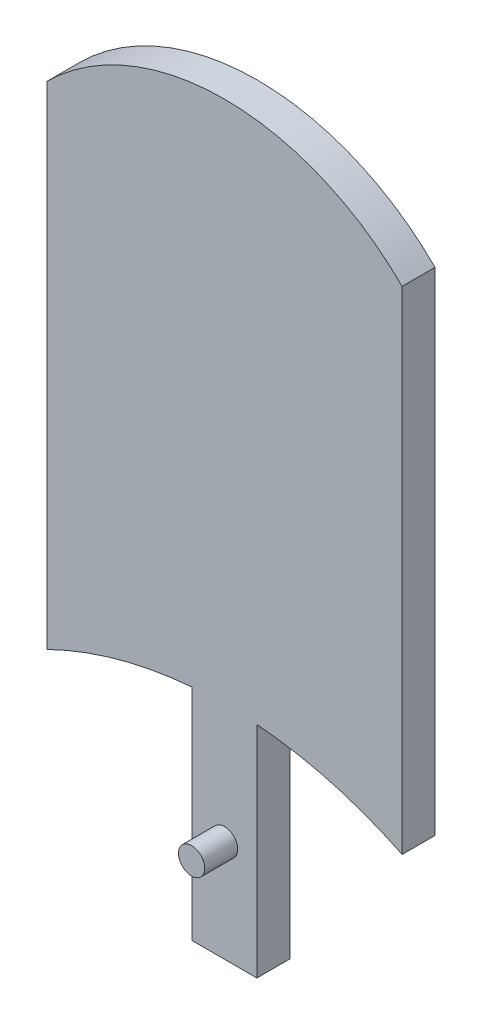
from build123d import *
from build123d.topology import SkipClean

# Parameters (mm, degrees)
BOSS_EXTRUDE1_DEPTH = 3.175
BOSS_EXTRUDE2_START = 3.175
BOSS_EXTRUDE2_DEPTH = 3.175
SKETCH3_W           = 6.236959702
SKETCH3_H           = 41.352711554
BOSS_EXTRUDE3_DEPTH = 3.175
BOSS_EXTRUDE4_DEPTH = 3.175
BOSS_EXTRUDE5_REACH = 47.548
SKETCH6_W           = 0.889
SKETCH6_H           = 43.066281197
CUT_EXTRUDE1_REACH  = 47.451


with BuildPart() as part:
    # Sketch1 → Boss-Extrude1 (new body)
    with BuildSketch(Plane.XY):
        with BuildLine():
            Line((-17.114253333, 23.707583903), (-17.114253333, -23.707583903))
            ThreePointArc((-17.114253333, -23.707583903), (0, -19.732802645), (17.114253333, -23.707583903))
            Line((17.114253333, -23.707583903), (17.114253333, 23.707583903))
            ThreePointArc((17.114253333, 23.707583903), (0, 30.782200079), (-17.114253333, 23.707583903))
        make_face()
    extrude(amount=BOSS_EXTRUDE1_DEPTH)

    # Sketch2 → Boss-Extrude2 (add)
    with SkipClean():  # the faces are left unmerged after this step: merging them gives an invalid solid
        with BuildSketch(Plane(origin=(0, 0, 0), x_dir=(-1, 0, 0), z_dir=(0, 0, -1)).offset(BOSS_EXTRUDE2_START)):
            with BuildLine():
                Line((1.65128862, 23.29835294), (1.65128862, -19.767928257))
                ThreePointArc((1.65128862, -19.767928257), (2.25262846, -19.798194915), (2.853426735, -19.837781624))
                Line((2.853426735, -19.837781624), (2.853426735, 23.29835294))
                Line((2.853426735, 23.29835294), (1.65128862, 23.29835294))
            make_face()
            with BuildLine():
                Line((-1.65128862, -19.767928257), (-1.65128862, 23.29835294))
                Line((-1.65128862, 23.29835294), (-2.853426735, 23.29835294))
                Line((-2.853426735, 23.29835294), (-2.853426735, -19.837781624))
                ThreePointArc((-2.853426735, -19.837781624), (-2.25262846, -19.798194915), (-1.65128862, -19.767928257))
            make_face()
        extrude(amount=-BOSS_EXTRUDE2_DEPTH)

    # Sketch3 → Boss-Extrude3 (add)
    with BuildSketch(Plane.XY.offset(3.175)):
        with Locations((0, -20.33746726)):
            Rectangle(SKETCH3_W, SKETCH3_H)
    extrude(amount=-BOSS_EXTRUDE3_DEPTH)

    # Sketch4 → Boss-Extrude4 (add)
    with BuildSketch(Plane.XY.offset(3.175)):
        with BuildLine():
            ThreePointArc((0, -32.471683403), (0.898025612, -32.099709016), (1.27, -31.201683403))
            ThreePointArc((1.27, -31.201683403), (-0.898025612, -30.303657791), (0, -32.471683403))
        make_face()
    extrude(amount=BOSS_EXTRUDE4_DEPTH)

    # Sketch6 → Boss-Extrude5 (add, up to next)
    with BuildSketch(Plane.ZY.offset(-1.65128862), mode=Mode.PRIVATE) as boss_extrude5_sk1:
        with Locations((-2.7305, 1.765212341)):
            Rectangle(SKETCH6_W, SKETCH6_H)
    boss_extrude5_tool1 = extrude(boss_extrude5_sk1.sketch, amount=BOSS_EXTRUDE5_REACH, mode=Mode.PRIVATE) - part.part
    add(boss_extrude5_tool1.solids().sort_by_distance((1.651289, 1.765212, -2.7305))[0])

    # Sketch8 → Cut-Extrude1 (cut, up to next)
    with BuildSketch(Plane(origin=(0, 0, -3.175), x_dir=(-1, 0, 0), z_dir=(0, 0, -1)), mode=Mode.PRIVATE) as cut_extrude1_sk1:
        Polygon((0, 23.29835294), (-1.016, 23.29835294), (-1.016, -19.767928257), (1.016, -19.767928257), (1.016, 23.29835294), align=None)
    cut_extrude1_tool1 = extrude(cut_extrude1_sk1.sketch, amount=-CUT_EXTRUDE1_REACH, mode=Mode.PRIVATE) & part.part
    add(cut_extrude1_tool1.solids().sort_by_distance((0, 1.765212, -3.175))[0], mode=Mode.SUBTRACT)


solid = part.part
